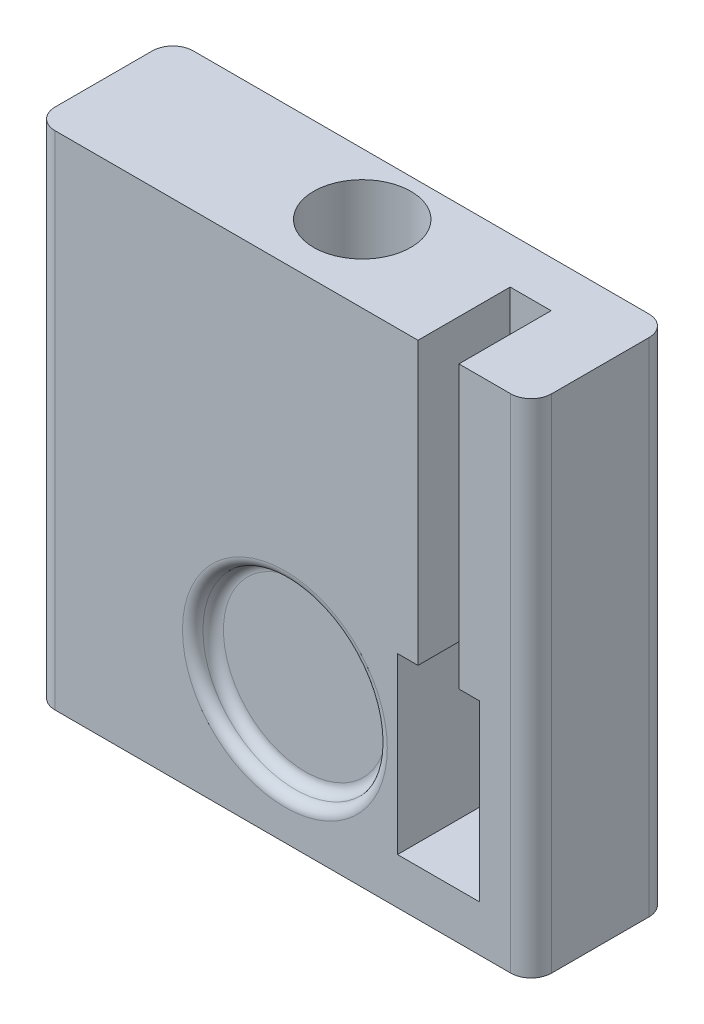
from build123d import *

# Parameters (mm, degrees)
EXTRUDE_1_DEPTH     = 49
SKETCH_2_W          = 8
SKETCH_2_H          = 17
CUT_EXTRUDE_1_DEPTH = 10
SKETCH_3_R          = 9
CUT_EXTRUDE_2_DEPTH = 2
FILLET_1_R          = 1
SKETCH_4_R          = 4.75
CUT_EXTRUDE_4_DEPTH = 40
SKETCH_5_W          = 4
SKETCH_5_H          = 10
CUT_EXTRUDE_5_DEPTH = 38
SKETCH_6_W          = 4
SKETCH_6_H          = 1
EXTRUDE_2_DEPTH     = 27.498032825


with BuildPart() as part:
    # 草图1 → 凸台-拉伸1 (new body)
    with BuildSketch(Plane.XZ.offset(-30.01474584)):
        with BuildLine():
            Line((43.696678655, -16.841019134), (-0.803321345, -16.841019134))
            ThreePointArc((-0.803321345, -16.841019134), (-2.217534907, -17.426805571), (-2.803321345, -18.841019134))
            Line((-2.803321345, -18.841019134), (-2.803321345, -28.341019134))
            ThreePointArc((-2.803321345, -28.341019134), (-2.217534907, -29.755232696), (-0.803321345, -30.341019134))
            Line((-0.803321345, -30.341019134), (43.696678655, -30.341019134))
            ThreePointArc((43.696678655, -30.341019134), (45.110892218, -29.755232696), (45.696678655, -28.341019134))
            Line((45.696678655, -28.341019134), (45.696678655, -18.841019134))
            ThreePointArc((45.696678655, -18.841019134), (45.110892218, -17.426805571), (43.696678655, -16.841019134))
        make_face()
    extrude(amount=EXTRUDE_1_DEPTH)

    # 草图2 → 切除-拉伸1 (cut)
    with BuildSketch(Plane.XY.offset(-16.841019134)):
        with Locations((36.643304361, -5.983286986)):
            Rectangle(SKETCH_2_W, SKETCH_2_H)
    extrude(amount=-CUT_EXTRUDE_1_DEPTH, mode=Mode.SUBTRACT)

    # 草图3 → 切除-拉伸2 (cut)
    with BuildSketch(Plane.XY.offset(-16.841019134)):
        with Locations((21.643304361, -5.983286986)):
            Circle(SKETCH_3_R)
    extrude(amount=-CUT_EXTRUDE_2_DEPTH, mode=Mode.SUBTRACT)

    # 圆角1
    fillet_1_edges = [part.edges().sort_by_distance(p)[0] for p in [
        (12.643304361, -5.983286986, -18.841019134),
        (12.643304361, -5.983286986, -16.841019134),
    ]]
    fillet(fillet_1_edges, radius=FILLET_1_R - 0.0001)  # a hair under: the kernel refuses the full size

    # 草图4 → 切除-拉伸4 (cut)
    with BuildSketch(Plane(origin=(0, 30.01474584, 0), x_dir=(1, 0, 0), z_dir=(0, 1, 0))):
        with Locations(Location((21.696678655, 24.341019134, 0), (0, 0, 270))):
            Circle(SKETCH_4_R)
    extrude(amount=-CUT_EXTRUDE_4_DEPTH, mode=Mode.SUBTRACT)

    # 草图5 → 切除-拉伸5 (cut)
    with BuildSketch(Plane(origin=(0, 30.01474584, 0), x_dir=(1, 0, 0), z_dir=(0, 1, 0))):
        with Locations((36.643304361, 21.841019134)):
            Rectangle(SKETCH_5_W, SKETCH_5_H)
    extrude(amount=-CUT_EXTRUDE_5_DEPTH, mode=Mode.SUBTRACT)

    # 草图6 → 凸台-拉伸2 (add)
    with BuildSketch(Plane(origin=(0, 30.01474584, 0), x_dir=(1, 0, 0), z_dir=(0, 1, 0))):
        with Locations((36.643304361, 26.341019134)):
            Rectangle(SKETCH_6_W, SKETCH_6_H)
    extrude(amount=-EXTRUDE_2_DEPTH)


solid = part.part
